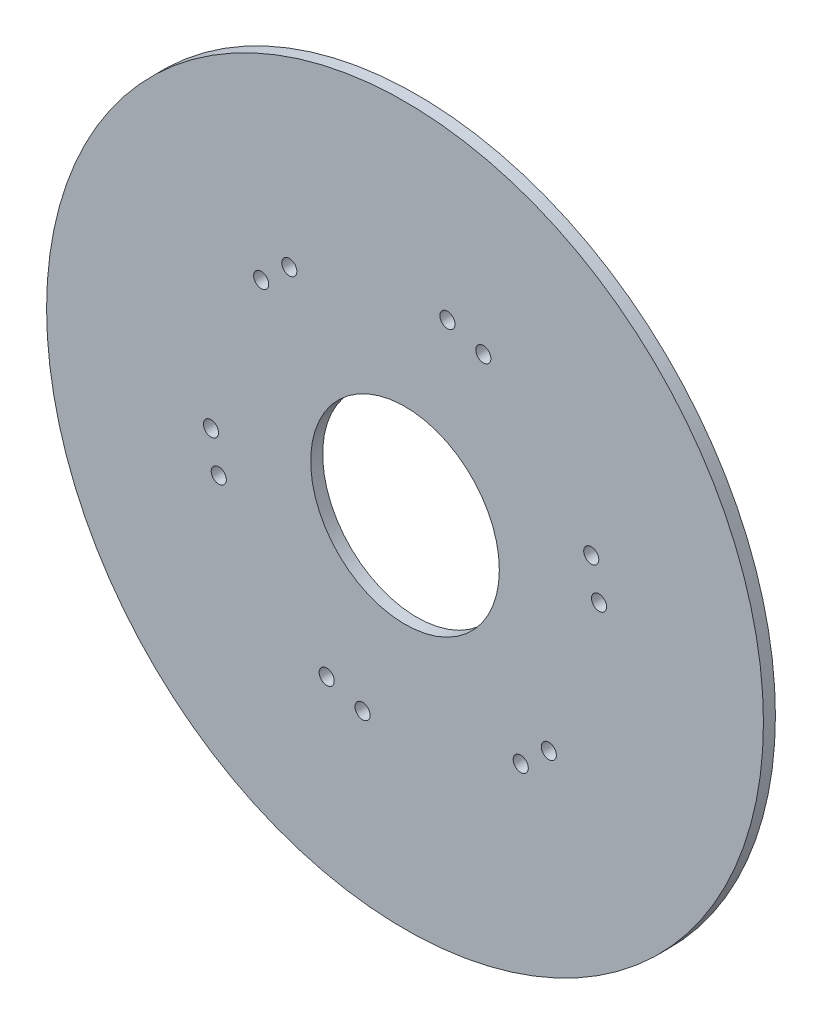
from build123d import *

# Parameters (mm, degrees)
SKETCH1_R           = 95
SKETCH1_R_2         = 25
BOSS_EXTRUDE1_DEPTH = 3.175
SKETCH2_R           = 2
CUT_EXTRUDE1_DEPTH  = 135.38779939


with BuildPart() as part:
    # Sketch1 → Boss-Extrude1 (new body)
    with BuildSketch(Plane.XY):
        Circle(SKETCH1_R)
        Circle(SKETCH1_R_2, mode=Mode.SUBTRACT)
    extrude(amount=BOSS_EXTRUDE1_DEPTH)

    # Sketch2 → Cut-Extrude1 (cut, through all)
    with BuildSketch(Plane(origin=(0, 0, 0), x_dir=(-1, 0, 0), z_dir=(0, 0, -1))):
        with Locations((-49.363135833, 15.509056087)):
            Circle(SKETCH2_R)
        with Locations((-51.424582128, 5.723840751)):
            Circle(SKETCH2_R)
        with Locations((-38.112804477, -34.995201598)):
            Circle(SKETCH2_R)
        with Locations((-30.669282562, -41.673074126)):
            Circle(SKETCH2_R)
        with Locations((11.250331356, -50.504257686)):
            Circle(SKETCH2_R)
        with Locations((20.755299566, -47.396914878)):
            Circle(SKETCH2_R)
        with Locations((49.363135833, -15.509056087)):
            Circle(SKETCH2_R)
        with Locations((51.424582128, -5.723840751)):
            Circle(SKETCH2_R)
        with Locations((38.112804477, 34.995201598)):
            Circle(SKETCH2_R)
        with Locations((30.669282562, 41.673074126)):
            Circle(SKETCH2_R)
        with Locations((-20.755299566, 47.396914878)):
            Circle(SKETCH2_R)
        with Locations((-11.250331356, 50.504257686)):
            Circle(SKETCH2_R)
    extrude(amount=-CUT_EXTRUDE1_DEPTH, mode=Mode.SUBTRACT)


solid = part.part
